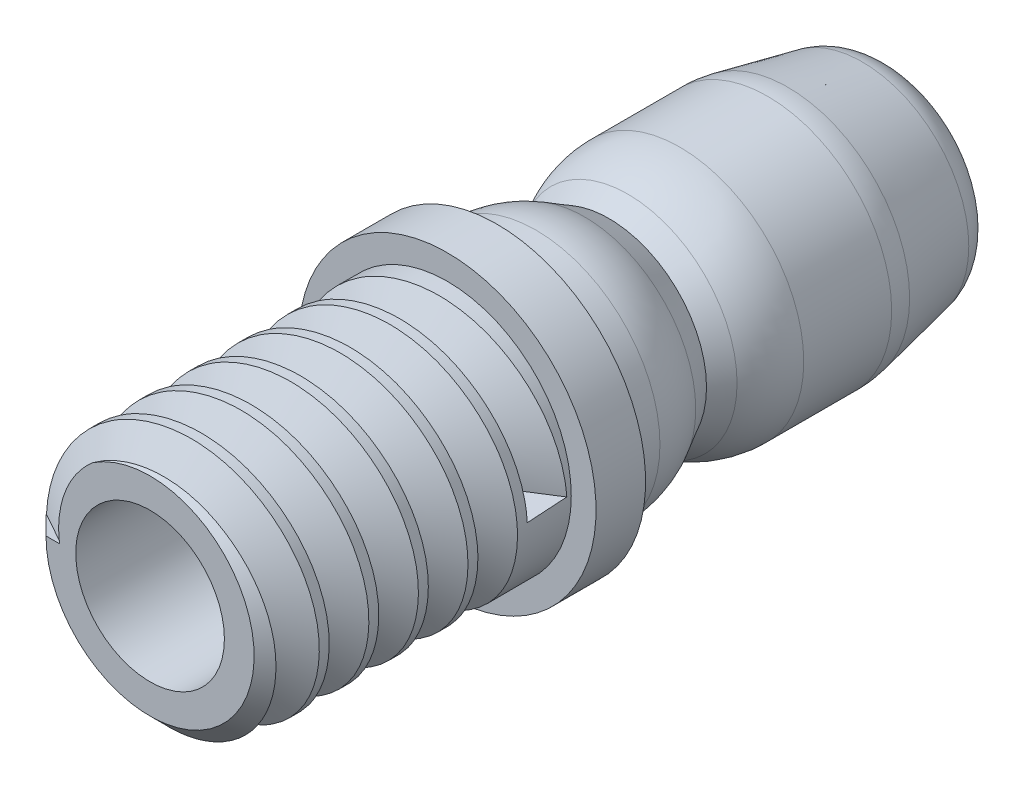
from build123d import *

# Parameters (mm, degrees)
SKETCH1_R              = 0.625
BOSS_EXTRUDE1_DEPTH    = 1.5
SKETCH2_R              = 0.75
BOSS_EXTRUDE2_DEPTH    = 0.25
CHAMFER1_SIZE          = 0.1
CUT_SWEEP1_PITCH       = 0.25
CUT_SWEEP1_HEIGHT      = 1.375
CUT_SWEEP1_RADIUS      = 0.625
BOSS_EXTRUDE3_START    = 2
SKETCH5_R              = 0.625
SKETCH5_R_2            = 0.375
BOSS_EXTRUDE3_DEPTH    = 2
FILLET1_R              = 0.5
FILLET2_R              = 0.2
CUT_EXTRUDE1_START     = -1.75
CUT_EXTRUDE1_OUTLINE_R = 0.375
CUT_EXTRUDE1_DEPTH     = 1.75


# Read off the part's stored shape, not the designer's step: Cut-Extrude1
with BuildPart() as part:
    # Sketch1 → Boss-Extrude1 (new body)
    with BuildSketch(Plane.XY):
        Circle(SKETCH1_R)
    extrude(amount=BOSS_EXTRUDE1_DEPTH)

    # Sketch2 → Boss-Extrude2 (add)
    with BuildSketch(Plane(origin=(0, 0, 0), x_dir=(-1, 0, 0), z_dir=(0, 0, -1))):
        Circle(SKETCH2_R)
    extrude(amount=BOSS_EXTRUDE2_DEPTH)

    # Chamfer1
    chamfer1_edges = [part.edges().sort_by_distance(p)[0] for p in [
        (-0.625, 0, 1.5),
    ]]
    chamfer(chamfer1_edges, length=CHAMFER1_SIZE)

    # Cut-Sweep1: sweep along a helix
    with BuildLine() as cut_sweep1_path:
        Helix(CUT_SWEEP1_PITCH, CUT_SWEEP1_HEIGHT, CUT_SWEEP1_RADIUS, center=(0, 0, 1.5), direction=(0, 0, -1))
    # Sketch4 → Cut-Sweep1 (sweep, cut)
    with BuildSketch(Plane(origin=(-0.625, 0, 1.5), x_dir=(1, 0, 0), z_dir=(-6.65527731272635e-15, 0.9979797151867817, -0.0635333619109695))):
        Polygon((0.173026415, 0.002653966), (-0.017499174, 0.112653966), (-0.017499174, -0.107346034), align=None)
    sweep(path=cut_sweep1_path.line, is_frenet=True, mode=Mode.SUBTRACT)

    # Sketch5 → Boss-Extrude3 (add)
    with BuildSketch(Plane(origin=(0, 0, -0.25), x_dir=(-1, 0, 0), z_dir=(0, 0, -1)).offset(BOSS_EXTRUDE3_START)):
        with Locations(Location((0, 0, 0), (0, 0, 359.41637989))):
            Circle(SKETCH5_R)
        Circle(SKETCH5_R_2, mode=Mode.SUBTRACT)
    extrude(amount=-BOSS_EXTRUDE3_DEPTH)

    # Sketch6 → Cut-Revolve1 (revolve, cut)
    with BuildSketch(Plane(origin=(0, 0, 0), x_dir=(1, 0, 0), z_dir=(0, 1, 0)), mode=Mode.PRIVATE) as cut_revolve1_sk:
        Polygon((-0.394723278, 2.784756525), (-0.723233911, 1.190711172), (-0.491995702, 0.815246115), (-0.625, 0.577847621), (-0.625, 0.25), (-0.84989967, 0.25), (-0.84989967, 2.784756525), align=None)
    revolve(cut_revolve1_sk.sketch.rotate(Axis((0, 0, 0), (0, 0, -1)), 359.41637989), axis=Axis((0, 0, 0), (0, 0, -1)), mode=Mode.SUBTRACT)

    # Fillet1
    fillet1_edges = [part.edges().sort_by_distance(p)[0] for p in [
        (0.624967576, 0.006366198, -0.577847621),
        (0.624967576, 0.006366198, -1.031207251),
        (0.624967576, 0.006366198, -1.667375527),
    ]]
    fillet(fillet1_edges, radius=FILLET1_R)

    # Fillet2
    # the kernel refuses this fillet: 0.2 mm, written as the material it takes off along each edge
    with BuildSketch(Plane(origin=(0, 0, -2.25), x_dir=(-0.9999481222083442, -0.010185916355747606, 0), z_dir=(-0.010185916355747606, 0.9999481222083442, 0))) as fillet2_piece_1:
        with BuildLine():
            CenterArc((0.341356053, 0.197149904), FILLET2_R, 279.68432686, 68.670838966)
            Line((0.375, 0), (0.375672879, -0.003942998))
            ThreePointArc((0.375672879, -0.003942998), (0.439964589, -0.004), (0.504929179, -0.004))
            Line((0.504929179, -0.004), (0.508846849, -0.000807378))
            Line((0.508846849, -0.000807378), (0.541157244, 0.155973651))
            Line((0.541157244, 0.155973651), (0.537239574, 0.156781028))
        make_face()
    revolve(axis=Axis((0, 0, -2.25), (0, 0, 1)), mode=Mode.SUBTRACT)

    # Cut-Extrude1 outline → Cut-Extrude1 (cut)
    with BuildSketch(Plane(origin=(0, 0, -0.25), x_dir=(-1, 0, 0), z_dir=(0, 0, -1)).offset(CUT_EXTRUDE1_START)):
        Circle(CUT_EXTRUDE1_OUTLINE_R)
    extrude(amount=CUT_EXTRUDE1_DEPTH, mode=Mode.SUBTRACT)


solid = part.part
